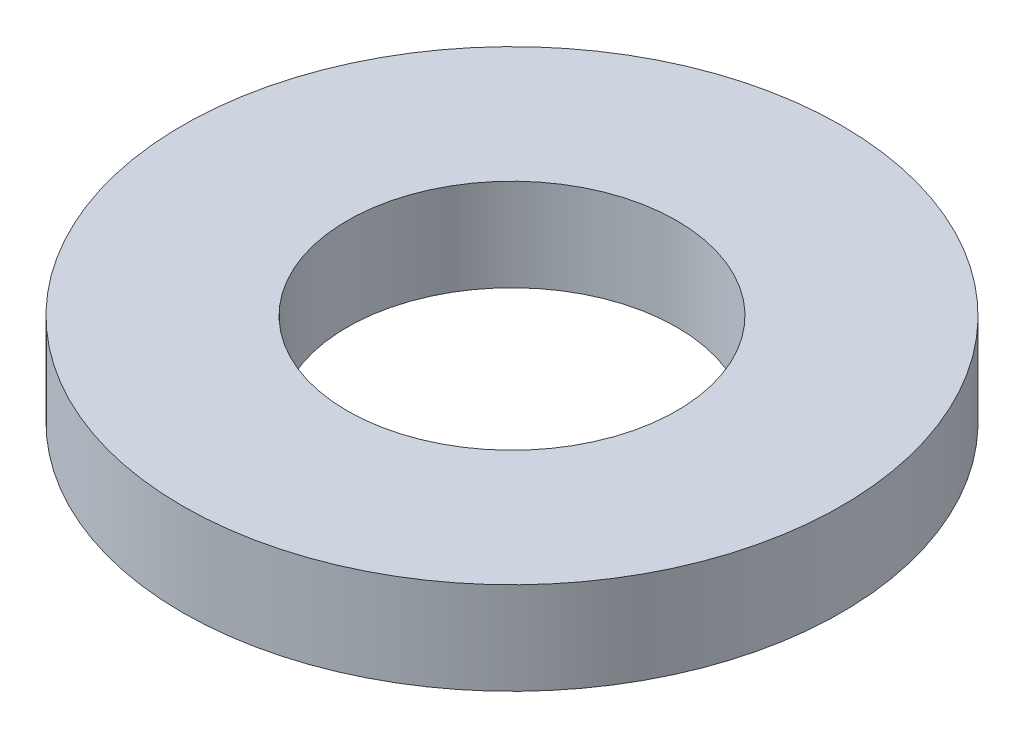
from build123d import *

# Parameters (mm, degrees)
SKETCH1_R           = 100
BOSS_EXTRUDE1_DEPTH = 28
SKETCH2_R           = 50
CUT_EXTRUDE1_DEPTH  = 145.166570328


with BuildPart() as part:
    # Sketch1 → Boss-Extrude1 (new body)
    with BuildSketch(Plane(origin=(0, 0, 0), x_dir=(1, 0, 0), z_dir=(0, 1, 0))):
        Circle(SKETCH1_R)
    extrude(amount=BOSS_EXTRUDE1_DEPTH)

    # Sketch2 → Cut-Extrude1 (cut, through all)
    with BuildSketch(Plane(origin=(0, 0, 0), x_dir=(1, 0, 0), z_dir=(0, 1, 0))):
        Circle(SKETCH2_R)
    extrude(amount=CUT_EXTRUDE1_DEPTH, mode=Mode.SUBTRACT)


solid = part.part
